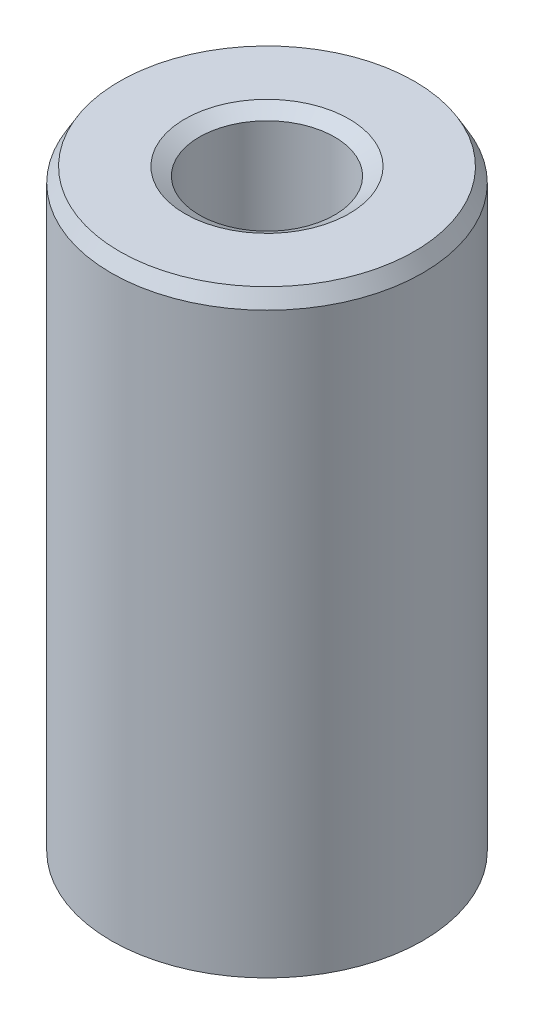
from build123d import *
from OCP.BRepFilletAPI import BRepFilletAPI_MakeChamfer

# Parameters (mm, degrees)
SKETCH1_R           = 17.5
BOSS_EXTRUDE1_DEPTH = 67.527914327
SKETCH2_R           = 7.597608997
CUT_EXTRUDE1_DEPTH  = 72.920228123
CHAMFER1_SIZE       = 1.627205943
CHAMFER1_SIZE2      = 0.939467789


with BuildPart() as part:
    # Sketch1 → Boss-Extrude1 (new body)
    with BuildSketch(Plane(origin=(0, 0, 0), x_dir=(1, 0, 0), z_dir=(0, 1, 0))):
        Circle(SKETCH1_R)
    extrude(amount=BOSS_EXTRUDE1_DEPTH)

    # Sketch2 → Cut-Extrude1 (cut, through all)
    with BuildSketch(Plane(origin=(0, 0, 0), x_dir=(1, 0, 0), z_dir=(0, 1, 0))):
        Circle(SKETCH2_R)
    extrude(amount=CUT_EXTRUDE1_DEPTH, mode=Mode.SUBTRACT)

    # Chamfer1: one chamfer whose edges measure the first distance from different faces: ONE call of the kernel's chamfer builder (chamfer() names one face for all edges)
    chamfer1_edges_1 = [part.edges().sort_by_distance(p)[0] for p in [
        (-7.597608997, 67.527914327, 0),
    ]]
    chamfer1_side_1 = [part.faces().sort_by_distance(p)[0] for p in [
        (-17.005025253, 67.527914327, 0),
    ]]
    chamfer1_edges_2 = [part.edges().sort_by_distance(p)[0] for p in [
        (-7.597608997, 0, 0),
    ]]
    chamfer1_side_2 = [part.faces().sort_by_distance(p)[0] for p in [
        (-7.597608997, 33.763957163, 0),
    ]]
    chamfer1_edges_3 = [part.edges().sort_by_distance(p)[0] for p in [
        (-17.5, 0, 0),
    ]]
    chamfer1_side_3 = [part.faces().sort_by_distance(p)[0] for p in [
        (-17.005025253, 0, 0),
    ]]
    chamfer1_edges_4 = [part.edges().sort_by_distance(p)[0] for p in [
        (-17.5, 67.527914327, 0),
    ]]
    chamfer1_side_4 = [part.faces().sort_by_distance(p)[0] for p in [
        (-17.5, 33.763957163, 0),
    ]]
    chamfer1 = BRepFilletAPI_MakeChamfer(part.part.solid().wrapped)
    for e in chamfer1_edges_1:
        chamfer1.Add(CHAMFER1_SIZE, CHAMFER1_SIZE2, e.wrapped, chamfer1_side_1[0].wrapped)  # the first distance lies on this face
    for e in chamfer1_edges_2:
        chamfer1.Add(CHAMFER1_SIZE, CHAMFER1_SIZE2, e.wrapped, chamfer1_side_2[0].wrapped)  # the first distance lies on this face
    for e in chamfer1_edges_3:
        chamfer1.Add(CHAMFER1_SIZE, CHAMFER1_SIZE2, e.wrapped, chamfer1_side_3[0].wrapped)  # the first distance lies on this face
    for e in chamfer1_edges_4:
        chamfer1.Add(CHAMFER1_SIZE, CHAMFER1_SIZE2, e.wrapped, chamfer1_side_4[0].wrapped)  # the first distance lies on this face
    add(Compound.cast(chamfer1.Shape()), mode=Mode.REPLACE)


solid = part.part
